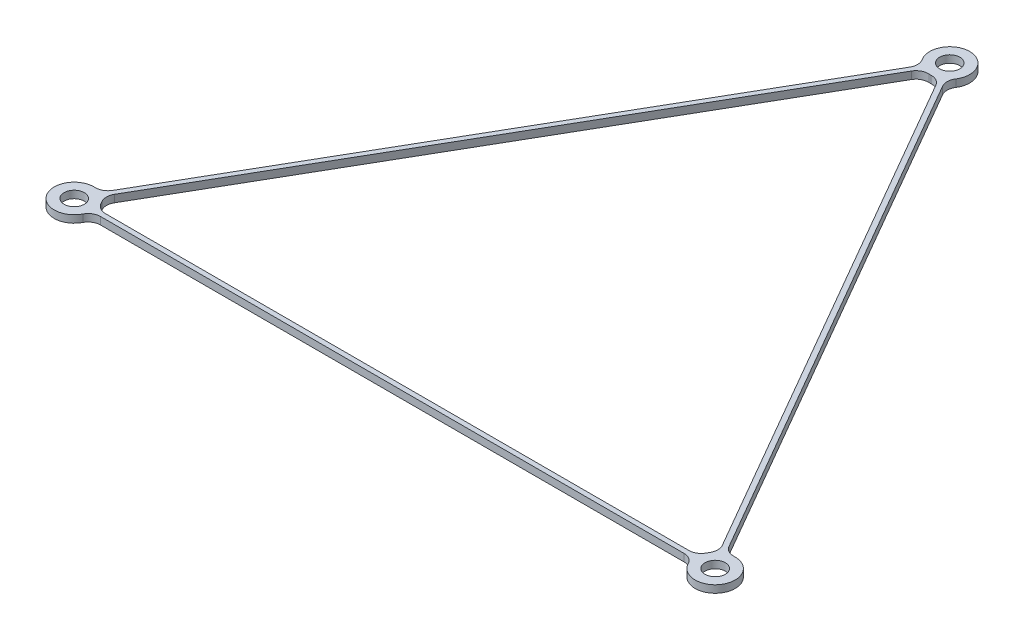
from build123d import *

# Parameters (mm, degrees)
SKETCH2_R        = 2.05
MAIN_SHAPE_DEPTH = 0.75
OUTSIDE_FILLET_R = 2.5
INSIDE_FILLET_R  = 2.5


with BuildPart() as part:
    # Sketch2 → main_shape (new, symmetric)
    with BuildSketch(Plane(origin=(0, 0, 0), x_dir=(1, 0, 0), z_dir=(0, 1, 0))):
        with BuildLine():
            Line((-63.423504055, -33.797196423), (-2.442521348, 71.824963921))
            ThreePointArc((-2.442521348, 71.824963921), (0, 79.105534995), (2.442521348, 71.824963921))
            Line((2.442521348, 71.824963921), (63.423504055, -33.797196423))
            ThreePointArc((63.423504055, -33.797196423), (68.507402885, -39.552767497), (60.980982707, -38.027767497))
            Line((60.980982707, -38.027767497), (-60.980982707, -38.027767497))
            ThreePointArc((-60.980982707, -38.027767497), (-68.507402885, -39.552767497), (-63.423504055, -33.797196423))
        make_face()
        with Locations((0, 75.055534995)):
            Circle(SKETCH2_R, mode=Mode.SUBTRACT)
        with Locations((65, -37.527767497)):
            Circle(SKETCH2_R, mode=Mode.SUBTRACT)
        with Locations((-65, -37.527767497)):
            Circle(SKETCH2_R, mode=Mode.SUBTRACT)
        with BuildLine():
            Line((-60.980982707, -37.027767497), (60.980982707, -37.027767497))
            ThreePointArc((60.980982707, -37.027767497), (61.492597115, -35.502767497), (62.557478652, -34.297196423))
            Line((62.557478652, -34.297196423), (1.576495945, 71.324963921))
            ThreePointArc((1.576495945, 71.324963921), (0, 71.005534995), (-1.576495945, 71.324963921))
            Line((-1.576495945, 71.324963921), (-62.557478652, -34.297196423))
            ThreePointArc((-62.557478652, -34.297196423), (-61.492597115, -35.502767497), (-60.980982707, -37.027767497))
        make_face(mode=Mode.SUBTRACT)
    extrude(amount=MAIN_SHAPE_DEPTH, both=True)

    # outside_fillet
    outside_fillet_edges = [part.edges().sort_by_distance(p)[0] for p in [
        (-2.442521348, 0, -71.824963921),
        (2.442521348, 0, -71.824963921),
        (63.423504055, 0, 33.797196423),
        (60.980982707, 0, 38.027767497),
        (-60.980982707, 0, 38.027767497),
        (-63.423504055, 0, 33.797196423),
    ]]
    fillet(outside_fillet_edges, radius=OUTSIDE_FILLET_R)

    # inside_fillet
    inside_fillet_edges = [part.edges().sort_by_distance(p)[0] for p in [
        (-62.557478652, 0, 34.297196423),
        (-60.980982707, 0, 37.027767497),
        (60.980982707, 0, 37.027767497),
        (62.557478652, 0, 34.297196423),
        (1.576495945, 0, -71.324963921),
        (-1.576495945, 0, -71.324963921),
    ]]
    fillet(inside_fillet_edges, radius=INSIDE_FILLET_R)


solid = part.part
